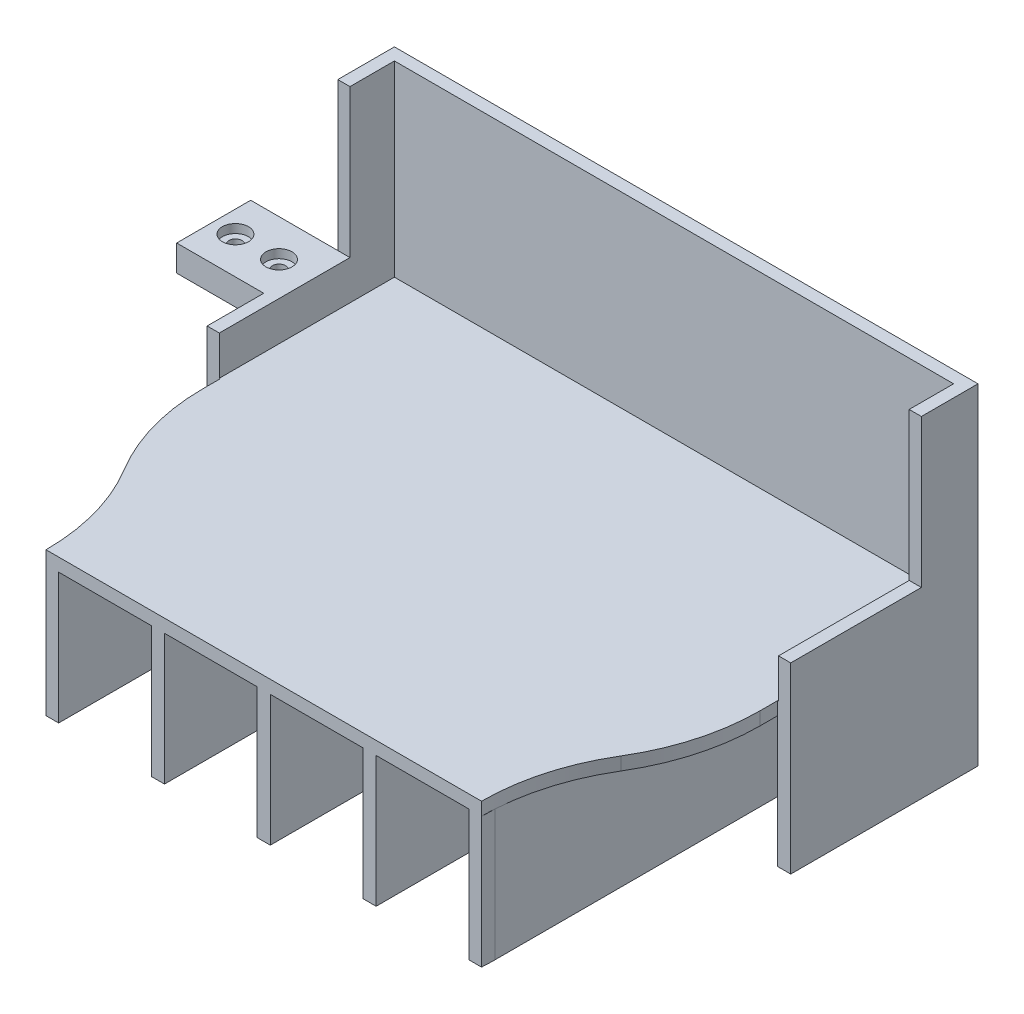
from build123d import *
from build123d.topology import SkipClean

# Parameters (mm, degrees)
SKETCH_1_R           = 10
SKETCH_1_W           = 40
SKETCH_1_H           = 40
EXTRUDE_1_DEPTH      = 2
EXTRUDE_START        = 2
SKETCH_2_R           = 10
EXTRUDE_2_DEPTH      = 2
SKETCH_4_R           = 15
EXTRUDE_3_DEPTH      = 8
EXTRUDE_START_2      = -8
SKETCH_7_R           = 15
SKETCH_7_R_2         = 10
EXTRUDE_4_DEPTH      = 8
SKETCH_11_R          = 15
SKETCH_11_R_2        = 10
EXTRUDE_5_DEPTH      = 8
FILLET_1_R           = 8
EXTRUDE_START_3      = -1
SKETCH_20_R          = 10
EXTRUDE_7_DEPTH      = 1
CUT_EXTRUDE_START    = -4
CUT_EXTRUDE_2_DEPTH  = 4
EXTRUDE_8_DEPTH      = 4
SKETCH_28_R          = 10
EXTRUDE_10_DEPTH     = 4
SKETCH_29_R          = 10
CUT_EXTRUDE_5_DEPTH  = 3
CUT_EXTRUDE_START_2  = -8
CUT_EXTRUDE_6_DEPTH  = 8
SKETCH_32_R          = 10
EXTRUDE_11_DEPTH     = 4
SKETCH_33_W          = 128
SKETCH_33_H          = 1
CUT_EXTRUDE_7_DEPTH  = 100
SKETCH_34_W          = 128
SKETCH_34_H          = 3
EXTRUDE_12_DEPTH     = 42
EXTRUDE_13_DEPTH     = 3
SKETCH_36_W          = 128
SKETCH_36_H          = 3
EXTRUDE_14_DEPTH     = 30
EXTRUDE_15_DEPTH     = 30
SKETCH_40_W          = 128
SKETCH_40_H          = 3
EXTRUDE_16_DEPTH     = 30
SKETCH_41_W          = 3
SKETCH_41_H          = 51
EXTRUDE_17_DEPTH     = 30
SKETCH_42_W          = 128
SKETCH_42_H          = 0.2
SKETCH_42_W_2        = 0.2
SKETCH_42_H_2        = 40
CUT_EXTRUDE_8_DEPTH  = 42
EXTRUDE_18_DEPTH     = 20
CUT_EXTRUDE_9_DEPTH  = 20
SKETCH_45_R          = 5
CUT_EXTRUDE_10_DEPTH = 3
SKETCH_46_W          = 17
SKETCH_46_H          = 6
EXTRUDE_19_DEPTH     = 20
SKETCH_47_W          = 20
SKETCH_47_H          = 6
CUT_EXTRUDE_11_DEPTH = 20
CUT_EXTRUDE_12_DEPTH = 20
SKETCH_49_R          = 3
CUT_EXTRUDE_13_DEPTH = 2
SKETCH_50_W          = 30
SKETCH_50_H          = 33
CUT_EXTRUDE_14_DEPTH = 3
SKETCH_51_W          = 128.4
SKETCH_51_H          = 2.8
EXTRUDE_20_DEPTH     = 1
SKETCH_52_W          = 128
SKETCH_52_H          = 3
SKETCH_52_W_2        = 94.187125454
CUT_EXTRUDE_15_DEPTH = 30
SKETCH_53_W          = 3
SKETCH_53_H          = 40
EXTRUDE_21_DEPTH     = 30
SKETCH_54_W          = 1.5
SKETCH_54_H          = 47
SKETCH_54_W_2        = 3
SKETCH_54_H_2        = 94
SKETCH_54_W_3        = 1.502846805
EXTRUDE_23_DEPTH     = 30
SKETCH_55_W          = 30
SKETCH_55_H          = 34
CUT_EXTRUDE_16_DEPTH = 200


with BuildPart() as part:
    # 草图1 → 凸台-拉伸1 (new body)
    with BuildSketch(Plane(origin=(0, 0, 0), x_dir=(1, 0, 0), z_dir=(0, 1, 0))):
        with BuildLine():
            Line((0, -20), (50, -20))
            Line((50, -20), (57, -20))
            ThreePointArc((57, -20), (76.798989873, -11.798989873), (85, 8))
            Line((85, 8), (85, 52))
            Line((85, 52), (43, 52))
            Line((43, 52), (43, 72))
            Line((43, 72), (-43, 72))
            Line((-43, 72), (-43, 52))
            Line((-43, 52), (-85, 52))
            Line((-85, 52), (-85, 50))
            Line((-85, 50), (-85, 8))
            ThreePointArc((-85, 8), (-76.798989873, -11.798989873), (-57, -20))
            Line((-57, -20), (-50, -20))
            Line((-50, -20), (0, -20))
        make_face()
        with Locations(Location((18, 0, 0), (0, 0, 270))):
            Circle(SKETCH_1_R, mode=Mode.SUBTRACT)
        with Locations(Location((-18, 0, 0), (0, 0, 270))):
            Circle(SKETCH_1_R, mode=Mode.SUBTRACT)
        with Locations((-21, 50)):
            Rectangle(SKETCH_1_W, SKETCH_1_H, mode=Mode.SUBTRACT)
        with Locations((21, 50)):
            Rectangle(SKETCH_1_W, SKETCH_1_H, mode=Mode.SUBTRACT)
        with Locations((-63, 30)):
            Rectangle(SKETCH_1_W, SKETCH_1_H, mode=Mode.SUBTRACT)
        with Locations((63, 30)):
            Rectangle(SKETCH_1_W, SKETCH_1_H, mode=Mode.SUBTRACT)
    extrude(amount=EXTRUDE_1_DEPTH)

    # 草图2 → 凸台-拉伸2 (add)
    with SkipClean():  # the faces are left unmerged after this step: merging them gives an invalid solid
        with BuildSketch(Plane.XZ.offset(EXTRUDE_START)):
            with BuildLine():
                Line((-85, -8), (-85, -52))
                Line((-85, -52), (-43, -52))
                Line((-43, -52), (-43, -72))
                Line((-43, -72), (43, -72))
                Line((43, -72), (43, -52))
                Line((43, -52), (85, -52))
                Line((85, -52), (85, -8))
                ThreePointArc((85, -8), (76.798989873, 11.798989873), (57, 20))
                Line((57, 20), (-57, 20))
                ThreePointArc((-57, 20), (-76.798989873, 11.798989873), (-85, -8))
            make_face()
            with Locations(Location((-18, 0, 0), (0, 0, 270))):
                Circle(SKETCH_2_R, mode=Mode.SUBTRACT)
            with Locations(Location((18, 0, 0), (0, 0, 270))):
                Circle(SKETCH_2_R, mode=Mode.SUBTRACT)
        extrude(amount=-EXTRUDE_2_DEPTH)

    # 草图4 → 凸台-拉伸3 (add)
    with BuildSketch(Plane(origin=(0, 2, 0), x_dir=(1, 0, 0), z_dir=(0, 1, 0))):
        with BuildLine():
            Line((-50, -20), (0, -20))
            Line((0, -20), (50, -20))
            ThreePointArc((50, -20), (0, 30), (-50, -20))
        make_face()
        with Locations(Location((-18, 0, 0), (0, 0, 270))):
            Circle(SKETCH_4_R, mode=Mode.SUBTRACT)
        with Locations(Location((18, 0, 0), (0, 0, 270))):
            Circle(SKETCH_4_R, mode=Mode.SUBTRACT)
    extrude(amount=EXTRUDE_3_DEPTH)

    # loft up to a face of the part (loft_1)
    loft([Face(Wire([part.edges().sort_by_distance((-28.934529411, 10, -10.268206589))[0]])), Face(Wire([part.edges().sort_by_distance((-25.289686274, 2, -6.845471059))[0]]))], mode=Mode.SUBTRACT)

    # 草图7 → 凸台-拉伸4 (add)
    with BuildSketch(Plane(origin=(0, 10, 0), x_dir=(1, 0, 0), z_dir=(0, 1, 0)).offset(EXTRUDE_START_2)):
        with Locations((-18, 0)):
            Circle(SKETCH_7_R)
        with Locations(Location((-18, 0, 0), (0, 0, 90))):
            Circle(SKETCH_7_R_2, mode=Mode.SUBTRACT)
    extrude(amount=EXTRUDE_4_DEPTH)

    # 切除-放样2: read off the stored shape, not the designer's step
    # 切除-放样2: loft between two sections, ruled curve by curve
    loft_2_from = [
        Edge.make_bspline([(-3.624862246, 10, -4.284321948), (4.943781649, 10, 24.465953561), (-23.806493859, 10, 33.034597456), (-32.375137754, 10, 4.284321948), (-40.943781649, 10, -24.465953561), (-12.193506141, 10, -33.034597456), (-3.624862246, 10, -4.284321948)], [0, 0, 0, 0, 0.5, 0.5, 0.5, 1, 1, 1, 1], 3, [1, 0.333333333, 0.333333333, 1, 0.333333333, 0.333333333, 1]),
    ]
    loft_2_to = [
        Edge.make_bspline([(-10.022055605, 2, -6.029295417), (2.036535229, 2, 9.926593374), (-13.919353562, 2, 21.985184208), (-25.977944395, 2, 6.029295417), (-38.036535229, 2, -9.926593374), (-22.080646438, 2, -21.985184208), (-10.022055605, 2, -6.029295417)], [0, 0, 0, 0, 0.5, 0.5, 0.5, 1, 1, 1, 1], 3, [1, 0.333333333, 0.333333333, 1, 0.333333333, 0.333333333, 1]),
    ]
    loft_2 = Solid(Shell([*[Face.make_surface_from_curves(loft_2_from[k], loft_2_to[k]) for k in range(1)], Face(Wire(loft_2_from)), Face(Wire(loft_2_to))]))
    add(loft_2, mode=Mode.SUBTRACT)

    # 草图11 → 凸台-拉伸5 (add)
    with BuildSketch(Plane(origin=(0, 10, 0), x_dir=(1, 0, 0), z_dir=(0, 1, 0)).offset(EXTRUDE_START_2)):
        with Locations((18, 0)):
            Circle(SKETCH_11_R)
        with Locations(Location((18, 0, 0), (0, 0, 90))):
            Circle(SKETCH_11_R_2, mode=Mode.SUBTRACT)
    extrude(amount=EXTRUDE_5_DEPTH)

    # 切除-放样3: read off the stored shape, not the designer's step
    # 切除-放样3: loft between two sections, ruled curve by curve
    loft_3_from = [
        Edge.make_bspline([(32.65702084, 10, -3.189316556), (39.035653951, 10, 26.124725125), (9.721612271, 10, 32.503358236), (3.34297916, 10, 3.189316556), (-3.035653951, 10, -26.124725125), (26.278387729, 10, -32.503358236), (32.65702084, 10, -3.189316556)], [0, 0, 0, 0, 0.5, 0.5, 0.5, 1, 1, 1, 1], 3, [1, 0.333333333, 0.333333333, 1, 0.333333333, 0.333333333, 1]),
    ]
    loft_3_to = [
        Edge.make_bspline([(26.664439789, 2, -4.992743049), (36.649925886, 2, 12.336136528), (19.321046309, 2, 22.321622626), (9.335560211, 2, 4.992743049), (-0.649925886, 2, -12.336136528), (16.678953691, 2, -22.321622626), (26.664439789, 2, -4.992743049)], [0, 0, 0, 0, 0.5, 0.5, 0.5, 1, 1, 1, 1], 3, [1, 0.333333333, 0.333333333, 1, 0.333333333, 0.333333333, 1]),
    ]
    loft_3 = Solid(Shell([*[Face.make_surface_from_curves(loft_3_from[k], loft_3_to[k]) for k in range(1)], Face(Wire(loft_3_from)), Face(Wire(loft_3_to))]))
    add(loft_3, mode=Mode.SUBTRACT)

    # 圆角1
    fillet_1_edges = [part.edges().sort_by_distance(p)[0] for p in [
        (0, 10, -30),
    ]]
    fillet(fillet_1_edges, radius=FILLET_1_R - 0.0001)  # a hair under: the kernel refuses the full size

    # 草图20 → 凸台-拉伸7 (add)
    with BuildSketch(Plane(origin=(0, 2, 0), x_dir=(1, 0, 0), z_dir=(0, 1, 0)).offset(EXTRUDE_START_3)):
        with Locations(Location((-18, 0, 0), (0, 0, 90))):
            Circle(SKETCH_20_R)
        with Locations(Location((18, 0, 0), (0, 0, 90))):
            Circle(SKETCH_20_R)
    extrude(amount=EXTRUDE_7_DEPTH)

    # 草图21 → 切除-拉伸2 (cut)
    with BuildSketch(Plane(origin=(0, 2, 0), x_dir=(1, 0, 0), z_dir=(0, 1, 0)).offset(CUT_EXTRUDE_START)):
        with BuildLine():
            Line((-50, -20), (-103.463459811, -20))
            Line((-103.463459811, -20), (-103.463459811, 85.086510942))
            Line((-103.463459811, 85.086510942), (103.21519716, 85.086510942))
            Line((103.21519716, 85.086510942), (103.21519716, -20))
            Line((103.21519716, -20), (50, -20))
            ThreePointArc((50, -20), (0, 30), (-50, -20))
        make_face()
    extrude(amount=CUT_EXTRUDE_2_DEPTH, mode=Mode.SUBTRACT)

    # 草图22 → 凸台-拉伸8 (add)
    with BuildSketch(Plane.XZ.offset(2)):
        with BuildLine():
            Line((-64, -30), (-64, -74))
            Line((-64, -74), (0, -74))
            Line((0, -74), (64, -74))
            Line((64, -74), (64, -30))
            ThreePointArc((64, -30), (62.216982092, -17.019245014), (57, -5))
            ThreePointArc((57, -5), (51.783017908, 7.019245014), (50, 20))
            ThreePointArc((50, 20), (0, -30), (-50, 20))
            ThreePointArc((-50, 20), (-51.783017908, 7.019245014), (-57, -5))
            ThreePointArc((-57, -5), (-62.216982092, -17.019245014), (-64, -30))
        make_face()
    extrude(amount=-EXTRUDE_8_DEPTH)

    # 草图28 → 凸台-拉伸10 (add)
    with BuildSketch(Plane.XZ.offset(2)):
        with Locations((-18, 0)):
            Circle(SKETCH_28_R)
        with Locations((18, 0)):
            Circle(SKETCH_28_R)
    extrude(amount=-EXTRUDE_10_DEPTH)

    # 草图29 → 切除-拉伸5 (cut)
    with BuildSketch(Plane(origin=(0, 2, 0), x_dir=(1, 0, 0), z_dir=(0, 1, 0))):
        with Locations(Location((-18, 0, 0), (0, 0, 270))):
            Circle(SKETCH_29_R)
        with Locations(Location((18, 0, 0), (0, 0, 270))):
            Circle(SKETCH_29_R)
    extrude(amount=-CUT_EXTRUDE_5_DEPTH, mode=Mode.SUBTRACT)

    # 草图31 → 切除-拉伸6 (cut)
    with BuildSketch(Plane(origin=(0, 10, 0), x_dir=(1, 0, 0), z_dir=(0, 1, 0)).offset(CUT_EXTRUDE_START_2)):
        with BuildLine():
            Line((-50, -20), (50, -20))
            ThreePointArc((50, -20), (0, 30), (-50, -20))
        make_face()
    extrude(amount=CUT_EXTRUDE_6_DEPTH, mode=Mode.SUBTRACT)

    # 草图32 → 凸台-拉伸11 (add)
    with BuildSketch(Plane(origin=(0, 2, 0), x_dir=(1, 0, 0), z_dir=(0, 1, 0))):
        with Locations((-18, 0)):
            Circle(SKETCH_32_R)
        with Locations((18, 0)):
            Circle(SKETCH_32_R)
    extrude(amount=-EXTRUDE_11_DEPTH)

    # 草图33 → 切除-拉伸7 (cut)
    with BuildSketch(Plane(origin=(0, 0, -74), x_dir=(-1, 0, 0), z_dir=(0, 0, -1))):
        with Locations((0, 1.5)):
            Rectangle(SKETCH_33_W, SKETCH_33_H)
    extrude(amount=-CUT_EXTRUDE_7_DEPTH, mode=Mode.SUBTRACT)



with BuildPart() as body_2:
    # 草图34 → 凸台-拉伸12 (new body)
    with BuildSketch(Plane(origin=(0, 1, 0), x_dir=(1, 0, 0), z_dir=(0, 1, 0))):
        Polygon((64, 77), (64, 74), (64, 34), (67, 34), (67, 77), align=None)
        with Locations((0, 75.5)):
            Rectangle(SKETCH_34_W, SKETCH_34_H)
        Polygon((-64, 34), (-64, 74), (-64, 77), (-67, 77), (-67, 34), align=None)
    extrude(amount=EXTRUDE_12_DEPTH)


with BuildPart() as part_1:
    add(part.part)

    add(body_2.part)  # 凸台-拉伸13 merges body 2
    # 草图35 → 凸台-拉伸13 (add)
    with BuildSketch(Plane.XZ.offset(2)):
        Polygon((-64, -34), (-67, -34), (-67, -77), (67, -77), (67, -34), (64, -34), (64, -74), (-64, -74), align=None)
    extrude(amount=-EXTRUDE_13_DEPTH)

    # 草图36 → 凸台-拉伸14 (add)
    with BuildSketch(Plane.XZ.offset(2)):
        Polygon((64, -34), (64, -74), (64, -77), (67, -77), (67, -34), align=None)
        with Locations((0, -75.5)):
            Rectangle(SKETCH_36_W, SKETCH_36_H)
        Polygon((-64, -34), (-67, -34), (-67, -77), (-64, -77), (-64, -74), align=None)
    extrude(amount=EXTRUDE_14_DEPTH)

    # 草图37 → 凸台-拉伸15 (add)
    with BuildSketch(Plane(origin=(0, -2, 0), x_dir=(-1, 0, 0), z_dir=(0, -1, 0))):
        with BuildLine():
            Line((0, -17), (-50.093562727, -17))
            ThreePointArc((-50.093562727, -17), (-50.07016636, -18.500729321), (-50, -20))
            Line((-50, -20), (50, -20))
            ThreePointArc((50, -20), (50.07016636, -18.500729321), (50.093562727, -17))
            Line((50.093562727, -17), (0, -17))
        make_face()
    extrude(amount=EXTRUDE_15_DEPTH)

    # 草图40 → 凸台-拉伸16 (add)
    with BuildSketch(Plane.XZ.offset(2)):
        with Locations((0, -35.5)):
            Rectangle(SKETCH_40_W, SKETCH_40_H)
    extrude(amount=EXTRUDE_16_DEPTH)

    # 草图41 → 凸台-拉伸17 (add)
    with BuildSketch(Plane.XZ.offset(2)):
        with Locations((-48.593562727, -8.5)):
            Rectangle(SKETCH_41_W, SKETCH_41_H)
        with Locations((48.593562727, -8.5)):
            Rectangle(SKETCH_41_W, SKETCH_41_H)
    extrude(amount=EXTRUDE_17_DEPTH)

    # 草图42 → 切除-拉伸8 (cut)
    with BuildSketch(Plane(origin=(0, 43, 0), x_dir=(1, 0, 0), z_dir=(0, 1, 0))):
        with Locations((0, 74.1)):
            Rectangle(SKETCH_42_W, SKETCH_42_H)
        with Locations((-64.1, 74.1)):
            Rectangle(SKETCH_42_W_2, SKETCH_42_H)
        with Locations((-64.1, 54)):
            Rectangle(SKETCH_42_W_2, SKETCH_42_H_2)
        with Locations((64.1, 54)):
            Rectangle(SKETCH_42_W_2, SKETCH_42_H_2)
        with Locations((64.1, 74.1)):
            Rectangle(SKETCH_42_W_2, SKETCH_42_H)
    extrude(amount=-CUT_EXTRUDE_8_DEPTH, mode=Mode.SUBTRACT)

    # 草图43 → 凸台-拉伸18 (add)
    with BuildSketch(Plane.ZY.offset(67)):
        Polygon((-45.5, -2), (-65.5, -2), (-65.5, 4), (-55.5, 4), (-45.5, 4), align=None)
    extrude(amount=EXTRUDE_18_DEPTH)

    # 草图44 → 切除-拉伸9 (cut)
    with BuildSketch(Plane(origin=(0, 4, 0), x_dir=(1, 0, 0), z_dir=(0, 1, 0))):
        with BuildLine():
            ThreePointArc((-74.4, 55.5), (-76.005023076, 57.902086785), (-78.838477631, 57.338477631))
            Line((-78.838477631, 57.338477631), (-75.161522369, 53.661522369))
            ThreePointArc((-75.161522369, 53.661522369), (-74.597913215, 54.505023076), (-74.4, 55.5))
        make_face()
        with BuildLine():
            Line((-75.161522369, 53.661522369), (-78.838477631, 57.338477631))
            ThreePointArc((-78.838477631, 57.338477631), (-78.838477631, 53.661522369), (-75.161522369, 53.661522369))
        make_face()
    extrude(amount=-CUT_EXTRUDE_9_DEPTH, mode=Mode.SUBTRACT)

    # 草图45 → 切除-拉伸10 (cut)
    with BuildSketch(Plane(origin=(0, 4, 0), x_dir=(1, 0, 0), z_dir=(0, 1, 0))):
        with Locations(Location((-77, 55.5, 0), (0, 0, 270))):
            Circle(SKETCH_45_R)
    extrude(amount=-CUT_EXTRUDE_10_DEPTH, mode=Mode.SUBTRACT)

    # 草图46 → 凸台-拉伸19 (add)
    with BuildSketch(Plane.ZY.offset(67)):
        with Locations((-55.5, 7)):
            Rectangle(SKETCH_46_W, SKETCH_46_H)
    extrude(amount=EXTRUDE_19_DEPTH)

    # 草图47 → 切除-拉伸11 (cut)
    with BuildSketch(Plane.ZY.offset(87)):
        with Locations((-55.5, 1)):
            Rectangle(SKETCH_47_W, SKETCH_47_H)
    extrude(amount=-CUT_EXTRUDE_11_DEPTH, mode=Mode.SUBTRACT)

    # 草图48 → 切除-拉伸12 (cut)
    with BuildSketch(Plane(origin=(0, 10, 0), x_dir=(1, 0, 0), z_dir=(0, 1, 0))):
        with BuildLine():
            ThreePointArc((-83.5, 55.5), (-82, 54), (-80.5, 55.5))
            Line((-80.5, 55.5), (-83.5, 55.5))
        make_face()
        with BuildLine():
            Line((-83.5, 55.5), (-80.5, 55.5))
            ThreePointArc((-80.5, 55.5), (-82, 57), (-83.5, 55.5))
        make_face()
        with BuildLine():
            ThreePointArc((-70.5, 55.5), (-72, 57), (-73.5, 55.5))
            Line((-73.5, 55.5), (-70.5, 55.5))
        make_face()
        with BuildLine():
            Line((-70.5, 55.5), (-73.5, 55.5))
            ThreePointArc((-73.5, 55.5), (-72, 54), (-70.5, 55.5))
        make_face()
    extrude(amount=-CUT_EXTRUDE_12_DEPTH, mode=Mode.SUBTRACT)

    # 草图49 → 切除-拉伸13 (cut)
    with BuildSketch(Plane(origin=(0, 10, 0), x_dir=(1, 0, 0), z_dir=(0, 1, 0))):
        with Locations(Location((-82, 55.5, 0), (0, 0, 270))):
            Circle(SKETCH_49_R)
        with Locations(Location((-72, 55.5, 0), (0, 0, 270))):
            Circle(SKETCH_49_R)
    extrude(amount=-CUT_EXTRUDE_13_DEPTH, mode=Mode.SUBTRACT)

    # 草图50 → 切除-拉伸14 (cut)
    with BuildSketch(Plane.ZY.offset(67)):
        with Locations((-49, 26.5)):
            Rectangle(SKETCH_50_W, SKETCH_50_H)
    extrude(amount=-CUT_EXTRUDE_14_DEPTH, mode=Mode.SUBTRACT)

    # 草图51 → 凸台-拉伸20 (add)
    with BuildSketch(Plane(origin=(0, 43, 0), x_dir=(1, 0, 0), z_dir=(0, 1, 0))):
        with Locations((0, 75.6)):
            Rectangle(SKETCH_51_W, SKETCH_51_H)
        Polygon((-67, 64), (-64.2, 64), (-64.2, 74.2), (-64.2, 77), (-67, 77), align=None)
        Polygon((64.2, 77), (64.2, 74.2), (64.2, 34), (67, 34), (67, 77), align=None)
    extrude(amount=EXTRUDE_20_DEPTH)

    # 草图52 → 切除-拉伸15 (cut)
    with BuildSketch(Plane.XZ.offset(32)):
        with Locations((0, -35.5)):
            Rectangle(SKETCH_52_W, SKETCH_52_H)
        with Locations((0, 18.5)):
            Rectangle(SKETCH_52_W_2, SKETCH_52_H)
    extrude(amount=-CUT_EXTRUDE_15_DEPTH, mode=Mode.SUBTRACT)

    # 草图53 → 凸台-拉伸21 (add)
    with BuildSketch(Plane.XZ.offset(2)):
        with Locations((-48.593562727, -54)):
            Rectangle(SKETCH_53_W, SKETCH_53_H)
        with Locations((48.593562727, -54)):
            Rectangle(SKETCH_53_W, SKETCH_53_H)
    extrude(amount=EXTRUDE_21_DEPTH)

    # 草图54 → 凸台-拉伸23 (add)
    with BuildSketch(Plane.XZ.offset(2)):
        Polygon((-22.796781363, 20), (-24.296781363, 20), (-24.296781363, -27), (-24.296781363, -74), (-22.796781363, -74), align=None)
        with Locations((-25.046781363, -3.5)):
            Rectangle(SKETCH_54_W, SKETCH_54_H)
        with Locations((-25.046781363, -50.5)):
            Rectangle(SKETCH_54_W, SKETCH_54_H)
        with Locations((0, -27)):
            Rectangle(SKETCH_54_W_2, SKETCH_54_H_2)
        with Locations((25.048204766, -3.5)):
            Rectangle(SKETCH_54_W_3, SKETCH_54_H)
        with Locations((23.546781363, -3.5)):
            Rectangle(SKETCH_54_W, SKETCH_54_H)
        with Locations((23.546781363, -50.5)):
            Rectangle(SKETCH_54_W, SKETCH_54_H)
        with Locations((25.048204766, -50.5)):
            Rectangle(SKETCH_54_W_3, SKETCH_54_H)
    extrude(amount=EXTRUDE_23_DEPTH)

    # 草图55 → 切除-拉伸16 (cut)
    with BuildSketch(Plane.ZY.offset(67)):
        with Locations((-49, 27)):
            Rectangle(SKETCH_55_W, SKETCH_55_H)
    extrude(amount=-CUT_EXTRUDE_16_DEPTH, mode=Mode.SUBTRACT)


solid = part_1.part
